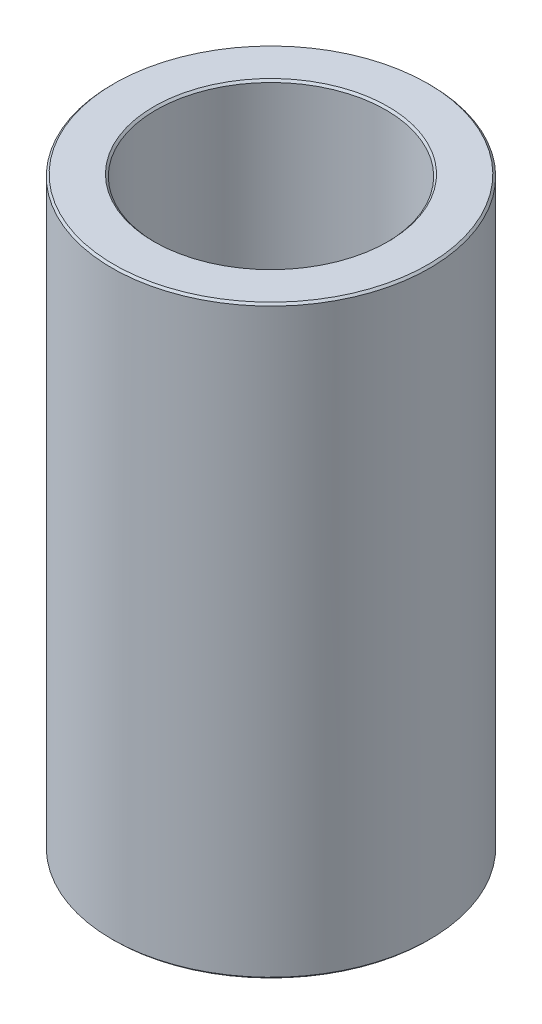
from build123d import *

# Parameters (mm, degrees)
SKETCH1_R           = 57.5
BOSS_EXTRUDE1_DEPTH = 211.796028498
SKETCH2_R           = 41.63833913
CUT_EXTRUDE1_DEPTH  = 227.870133969
CHAMFER1_SIZE       = 0.728195884


with BuildPart() as part:
    # Sketch1 → Boss-Extrude1 (new body)
    with BuildSketch(Plane(origin=(0, 0, 0), x_dir=(1, 0, 0), z_dir=(0, 1, 0))):
        Circle(SKETCH1_R)
    extrude(amount=BOSS_EXTRUDE1_DEPTH)

    # Sketch2 → Cut-Extrude1 (cut, through all)
    with BuildSketch(Plane(origin=(0, 0, 0), x_dir=(1, 0, 0), z_dir=(0, 1, 0))):
        Circle(SKETCH2_R)
    extrude(amount=CUT_EXTRUDE1_DEPTH, mode=Mode.SUBTRACT)

    # Chamfer1
    chamfer1_edges = [part.edges().sort_by_distance(p)[0] for p in [
        (-41.63833913, 211.796028498, 0),
        (-41.63833913, 0, 0),
        (-57.5, 0, 0),
        (-57.5, 211.796028498, 0),
    ]]
    chamfer(chamfer1_edges, length=CHAMFER1_SIZE)


solid = part.part
